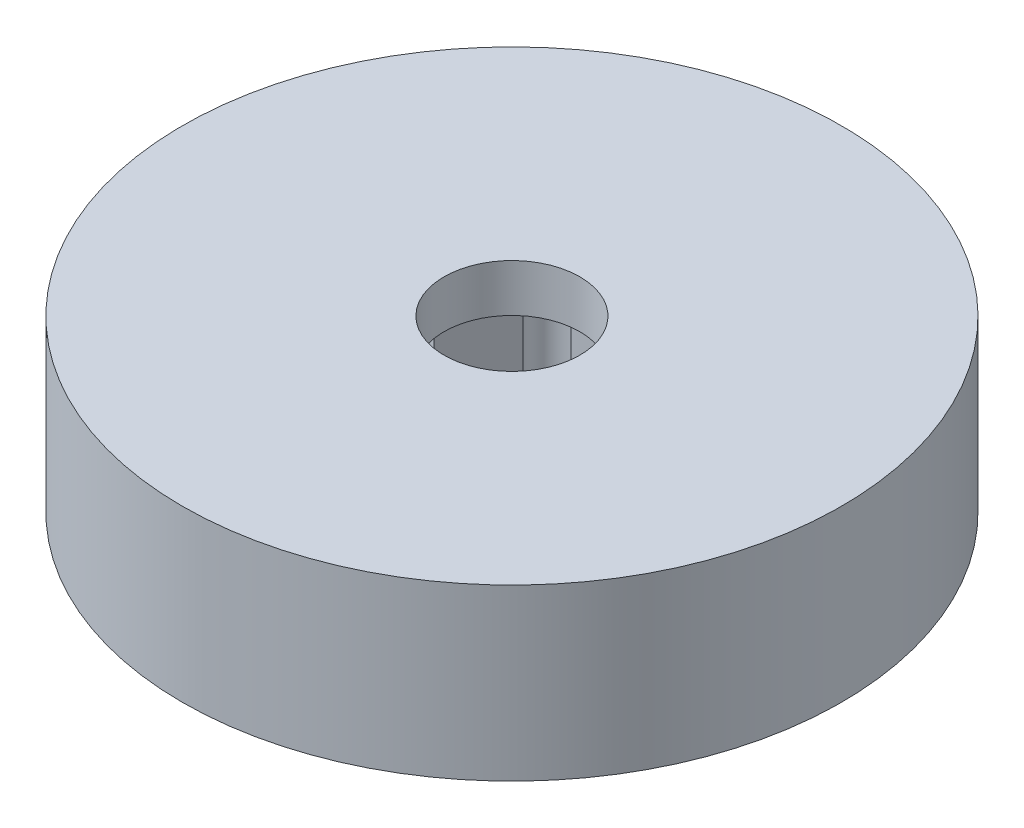
from build123d import *

# Parameters (mm, degrees)
SKETCH1_R              = 24.257
BOSS_EXTRUDE1_DEPTH    = 12.5
F_10_0MM_DOWEL_HOLE1_D = 10
CUT_EXTRUDE1_DEPTH     = 9
CUT_EXTRUDE3_DEPTH     = 10


with BuildPart() as part:
    # Sketch1 → Boss-Extrude1 (new body)
    with BuildSketch(Plane(origin=(0, 0, 0), x_dir=(1, 0, 0), z_dir=(0, 1, 0))):
        Circle(SKETCH1_R)
    extrude(amount=BOSS_EXTRUDE1_DEPTH)

    # Ø10.0mm Dowel Hole1 (through all)
    with Locations(Plane(origin=(0, 0, 0), x_dir=(-1, 0, 0), z_dir=(0, -1, 0))):
        with Locations((0, 0)):
            Hole(F_10_0MM_DOWEL_HOLE1_D / 2)

    # Sketch4 → Cut-Extrude1 (cut)
    with BuildSketch(Plane(origin=(0, 0, 0), x_dir=(-1, 0, 0), z_dir=(0, -1, 0))):
        Polygon((-3.897114317, -6.75), (3.897114317, -6.75), (7.794228634, 0), (3.897114317, 6.75), (-3.897114317, 6.75), (-7.794228634, 0), align=None)
    extrude(amount=-CUT_EXTRUDE1_DEPTH, mode=Mode.SUBTRACT)

    # Sketch5 → Cut-Extrude3 (cut)
    with BuildSketch(Plane.XZ):
        with BuildLine():
            Line((-7.794228634, 0), (-7.044228634, 1.299038106))
            ThreePointArc((-7.044228634, 1.299038106), (-9.294228634, 0), (-7.044228634, -1.299038106))
            Line((-7.044228634, -1.299038106), (-7.794228634, 0))
        make_face()
        with BuildLine():
            ThreePointArc((-2.397114317, 6.75), (-4.647114317, 8.049038106), (-4.647114317, 5.450961894))
            Line((-4.647114317, 5.450961894), (-3.897114317, 6.75))
            Line((-3.897114317, 6.75), (-2.397114317, 6.75))
        make_face()
        with BuildLine():
            Line((-3.897114317, -6.75), (-4.647114317, -5.450961894))
            ThreePointArc((-4.647114317, -5.450961894), (-4.647114317, -8.049038106), (-2.397114317, -6.75))
            Line((-2.397114317, -6.75), (-3.897114317, -6.75))
        make_face()
        with BuildLine():
            ThreePointArc((4.647114317, 5.450961894), (4.647114317, 8.049038106), (2.397114317, 6.75))
            Line((2.397114317, 6.75), (3.897114317, 6.75))
            Line((3.897114317, 6.75), (4.647114317, 5.450961894))
        make_face()
        with BuildLine():
            Line((3.897114317, -6.75), (2.397114317, -6.75))
            ThreePointArc((2.397114317, -6.75), (4.647114317, -8.049038106), (4.647114317, -5.450961894))
            Line((4.647114317, -5.450961894), (3.897114317, -6.75))
        make_face()
        with BuildLine():
            ThreePointArc((7.044228634, -1.299038106), (9.294228634, 0), (7.044228634, 1.299038106))
            Line((7.044228634, 1.299038106), (7.794228634, 0))
            Line((7.794228634, 0), (7.044228634, -1.299038106))
        make_face()
    extrude(amount=-CUT_EXTRUDE3_DEPTH, mode=Mode.SUBTRACT)


solid = part.part
